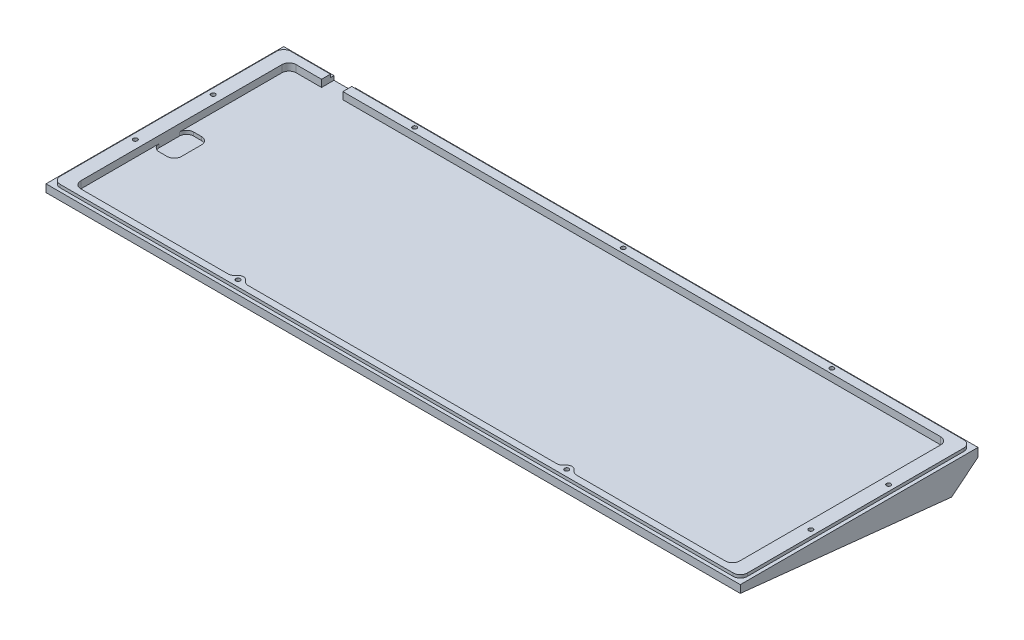
from build123d import *

# Parameters (mm, degrees)
SKETCH1_W               = 390.8
SKETCH1_H               = 133.8
BOSS_EXTRUDE1_DEPTH     = 6
SKETCH2_W               = 370.8
SKETCH2_H               = 125.6
CUT_EXTRUDE1_DEPTH      = 4
BOSS_EXTRUDE3_DEPTH     = 390.8
BOSS_EXTRUDE4_DEPTH     = 4
CUT_EXTRUDE6_DEPTH      = 414.309625425
CUT_EXTRUDE6_DEPTH_BACK = 414.309625425
SKETCH15_R              = 5
CUT_EXTRUDE8_DEPTH      = 1
SKETCH16_W              = 12.5
SKETCH16_H              = 19.4
CUT_EXTRUDE9_DEPTH      = 6
SKETCH17_W              = 390.8
SKETCH17_H              = 133.8
SKETCH17_W_2            = 386.8
SKETCH17_H_2            = 129.8
CUT_EXTRUDE10_DEPTH     = 1.7
SKETCH18_W              = 370.8
SKETCH18_H              = 4.4
BOSS_EXTRUDE5_DEPTH     = 4
M2_CLEARANCE_HOLE1_D    = 2.4
CUT_EXTRUDE7_START      = -4
SKETCH13_R              = 2.5
CUT_EXTRUDE7_DEPTH      = 410.484592101
CUT_EXTRUDE11_START     = -5
SKETCH19_R              = 2.5
CUT_EXTRUDE11_DEPTH     = 409.484592101
SKETCH20_W              = 12
SKETCH20_H              = 4
CUT_EXTRUDE12_DEPTH     = 10
FILLET1_R               = 4
FILLET2_R               = 4


# Read off the part's stored shape, not the designer's step: Boss-Extrude3
with BuildPart() as part:
    # Sketch1 → Boss-Extrude1 (new body)
    with BuildSketch(Plane(origin=(0, 0, 0), x_dir=(1, 0, 0), z_dir=(0, 1, 0))):
        with Locations((195.4, 66.9)):
            Rectangle(SKETCH1_W, SKETCH1_H)
    extrude(amount=BOSS_EXTRUDE1_DEPTH)

    # Sketch2 → Cut-Extrude1 (cut)
    with BuildSketch(Plane(origin=(0, 6, 0), x_dir=(1, 0, 0), z_dir=(0, 1, 0))):
        with Locations((195.4, 68.4)):
            Rectangle(SKETCH2_W, SKETCH2_H)
    extrude(amount=-CUT_EXTRUDE1_DEPTH, mode=Mode.SUBTRACT)

    # Boss-Extrude3 outline → Boss-Extrude3 (add)
    with BuildSketch(Plane.YZ):
        Polygon((-14.062946679, -133.8), (0, -133.8), (0, 0), align=None)
    extrude(amount=BOSS_EXTRUDE3_DEPTH)

    # Sketch10 → Boss-Extrude4 (add)
    with BuildSketch(Plane(origin=(0, 2, 0), x_dir=(1, 0, 0), z_dir=(0, 1, 0))):
        with BuildLine():
            ThreePointArc((290.5, 5.6), (287.5, 8.6), (284.5, 5.6))
            Line((284.5, 5.6), (290.5, 5.6))
        make_face()
        with BuildLine():
            Line((290.5, 5.6), (284.5, 5.6))
            ThreePointArc((284.5, 5.6), (287.5, 2.6), (290.5, 5.6))
        make_face()
        with BuildLine():
            Line((99.5, 5.6), (105.5, 5.6))
            ThreePointArc((105.5, 5.6), (102.5, 8.6), (99.5, 5.6))
        make_face()
        with BuildLine():
            ThreePointArc((99.5, 5.6), (102.5, 2.6), (105.5, 5.6))
            Line((105.5, 5.6), (99.5, 5.6))
        make_face()
    extrude(amount=BOSS_EXTRUDE4_DEPTH)

    # Sketch12 → Cut-Extrude6 (cut, two sides: drawn at the far end of the back side and taken through both)
    with BuildSketch(Plane.ZY.offset(-CUT_EXTRUDE6_DEPTH_BACK)):
        Polygon((-133.8, -14.062946679), (-118.975297196, -12.504807627), (-133.8, -0.5), align=None)
    extrude(amount=CUT_EXTRUDE6_DEPTH + CUT_EXTRUDE6_DEPTH_BACK, mode=Mode.SUBTRACT)

    # Sketch15 → Cut-Extrude8 (cut)
    with BuildSketch(Plane(origin=(0, 0, 0), x_dir=(1, 0, 0), z_dir=(0, -0.9945218953682742, 0.10452846326764666))):
        with Locations(Location((15, -109.630646394, 0), (0, 0, 270))):
            Circle(SKETCH15_R)
        with Locations(Location((375.8, -109.630646394, 0), (0, 0, 270))):
            Circle(SKETCH15_R)
        with Locations(Location((15, -10, 0), (0, 0, 270))):
            Circle(SKETCH15_R)
        with Locations(Location((375.8, -10, 0), (0, 0, 270))):
            Circle(SKETCH15_R)
    extrude(amount=-CUT_EXTRUDE8_DEPTH, mode=Mode.SUBTRACT)

    # Sketch16 → Cut-Extrude9 (cut)
    with BuildSketch(Plane(origin=(0, 6, 0), x_dir=(1, 0, 0), z_dir=(0, 1, 0))):
        with Locations((16.25, 59.4)):
            Rectangle(SKETCH16_W, SKETCH16_H)
    extrude(amount=-CUT_EXTRUDE9_DEPTH, mode=Mode.SUBTRACT)

    # Sketch17 → Cut-Extrude10 (cut)
    with BuildSketch(Plane(origin=(0, 6, 0), x_dir=(1, 0, 0), z_dir=(0, 1, 0))):
        with Locations((195.4, 66.9)):
            Rectangle(SKETCH17_W, SKETCH17_H)
        with Locations((195.4, 66.9)):
            Rectangle(SKETCH17_W_2, SKETCH17_H_2, mode=Mode.SUBTRACT)
    extrude(amount=-CUT_EXTRUDE10_DEPTH, mode=Mode.SUBTRACT)

    # Sketch18 → Boss-Extrude5 (add)
    with BuildSketch(Plane(origin=(0, 2, 0), x_dir=(1, 0, 0), z_dir=(0, 1, 0))):
        with Locations((195.4, 129)):
            Rectangle(SKETCH18_W, SKETCH18_H)
    extrude(amount=BOSS_EXTRUDE5_DEPTH)

    # M2 Clearance Hole1 (through all)
    with Locations(Plane(origin=(102.5, 6, -5.6), x_dir=(0, 0, 1), z_dir=(0, 1, 0))):
        with Locations((0, 0), (-39.4, -97.2), (-83.2, -97.2), (-83.2, 283), (-39.4, 283), (0, 185), (-123.9, 92.907395227), (-123.9, -24.518527842), (-123.9, 210.318527842)):
            Hole(M2_CLEARANCE_HOLE1_D / 2)

    # Sketch13 → Cut-Extrude7 (cut, through all)
    with BuildSketch(Plane(origin=(0, 6, 0), x_dir=(1, 0, 0), z_dir=(0, 1, 0)).offset(CUT_EXTRUDE7_START)):
        with Locations(Location((5.3, 45, 0), (0, 0, 270))):
            Circle(SKETCH13_R)
        with Locations(Location((5.3, 88.8, 0), (0, 0, 270))):
            Circle(SKETCH13_R)
        with Locations(Location((102.5, 5.6, 0), (0, 0, 270))):
            Circle(SKETCH13_R)
        with Locations(Location((287.5, 5.6, 0), (0, 0, 270))):
            Circle(SKETCH13_R)
        with Locations(Location((385.5, 45, 0), (0, 0, 270))):
            Circle(SKETCH13_R)
        with Locations(Location((385.5, 88.8, 0), (0, 0, 270))):
            Circle(SKETCH13_R)
    extrude(amount=-CUT_EXTRUDE7_DEPTH, mode=Mode.SUBTRACT)

    # Sketch19 → Cut-Extrude11 (cut, through all)
    with BuildSketch(Plane(origin=(0, 6, 0), x_dir=(1, 0, 0), z_dir=(0, 1, 0)).offset(CUT_EXTRUDE11_START)):
        with Locations(Location((77.981472158, 129.5, 0), (0, 0, 270))):
            Circle(SKETCH19_R)
        with Locations(Location((195.407395227, 129.5, 0), (0, 0, 270))):
            Circle(SKETCH19_R)
        with Locations(Location((312.818527842, 129.5, 0), (0, 0, 270))):
            Circle(SKETCH19_R)
    extrude(amount=-CUT_EXTRUDE11_DEPTH, mode=Mode.SUBTRACT)

    # Sketch20 → Cut-Extrude12 (cut)
    with BuildSketch(Plane(origin=(0, 0, -133.8), x_dir=(-1, 0, 0), z_dir=(0, 0, -1))):
        with Locations((-34.3, 4)):
            Rectangle(SKETCH20_W, SKETCH20_H)
    extrude(amount=-CUT_EXTRUDE12_DEPTH, mode=Mode.SUBTRACT)

    # Fillet1
    fillet1_edges = [part.edges().sort_by_distance(p)[0] for p in [
        (2, 5.15, -131.8),
        (2, 5.15, -2),
        (388.8, 5.15, -2),
        (388.8, 5.15, -131.8),
        (380.8, 4, -126.8),
        (10, 4, -126.8),
        (10, 4, -5.6),
        (380.8, 4, -5.6),
        (10, 1, -49.7),
        (10, 1, -69.1),
        (22.5, 1, -69.1),
        (22.5, 1, -49.7),
    ]]
    fillet(fillet1_edges, radius=FILLET1_R)

    # Fillet2
    fillet2_edges = [part.edges().sort_by_distance(p)[0] for p in [
        (290.5, 4, -5.6),
        (284.5, 4, -5.6),
        (105.5, 4, -5.6),
        (99.5, 4, -5.6),
    ]]
    fillet(fillet2_edges, radius=FILLET2_R)


solid = part.part
